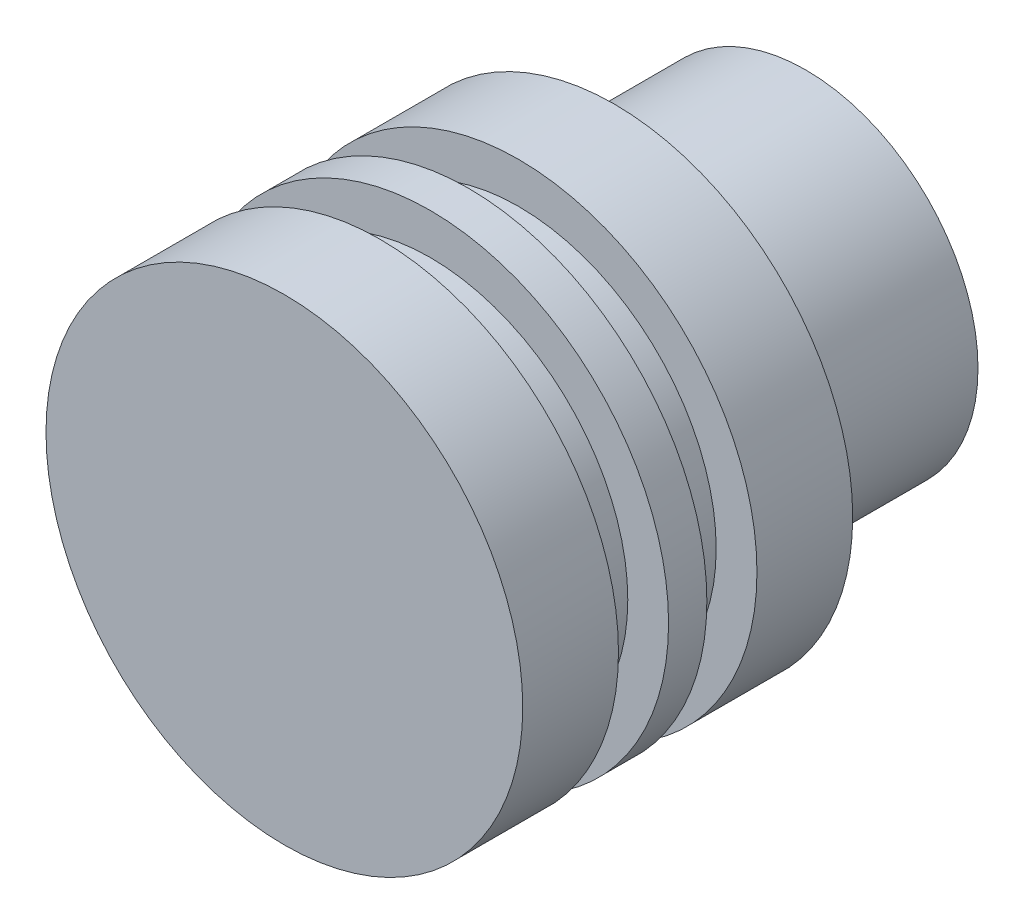
from build123d import *

# Parameters (mm, degrees)
SKETCH3_R           = 8.99487737
SKETCH3_R_2         = 5.99487737
BOSS_EXTRUDE4_DEPTH = 10


with BuildPart() as part:
    # Sketch2 → Revolve1 (revolve)
    with BuildSketch(Plane(origin=(0, 0, 0), x_dir=(0, 0, -1), z_dir=(1, 0, 0))):
        Polygon((0, 0), (0, 12.45), (-5, 12.45), (-5, 10.32), (-7.6162, 10.32), (-7.6162, 12.45), (-9.6162, 12.45), (-9.6162, 10.32), (-12.2324, 10.32), (-12.2324, 12.45), (-17.2324, 12.45), (-17.2324, 0), align=None)
    revolve(axis=Axis((0, 0, 17.2324), (0, 0, -1)))

    # Sketch3 → Boss-Extrude4 (add)
    with BuildSketch(Plane(origin=(0, 0, 0), x_dir=(-1, 0, 0), z_dir=(0, 0, -1))):
        Circle(SKETCH3_R)
        Circle(SKETCH3_R_2, mode=Mode.SUBTRACT)
    extrude(amount=BOSS_EXTRUDE4_DEPTH)


solid = part.part
